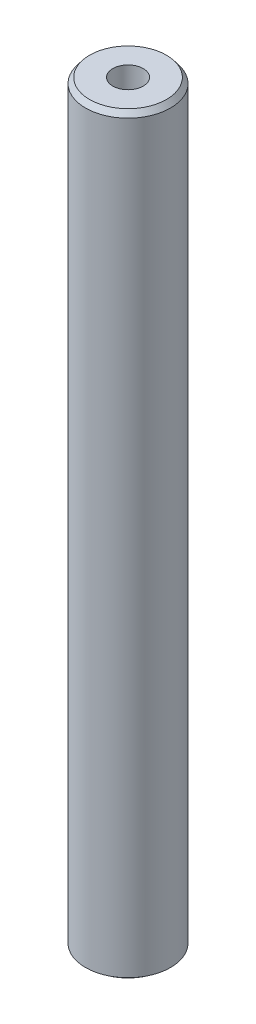
from build123d import *
from OCP.BRepFilletAPI import BRepFilletAPI_MakeChamfer

# Parameters (mm, degrees)
SKETCH1_R           = 17.5
BOSS_EXTRUDE1_DEPTH = 310.649268109
SKETCH2_R           = 6.274847593
CUT_EXTRUDE1_DEPTH  = 312.633547258
CHAMFER1_SIZE       = 2.213915599
CHAMFER1_SIZE2      = 1.661453647


with BuildPart() as part:
    # Sketch1 → Boss-Extrude1 (new body)
    with BuildSketch(Plane(origin=(0, 0, 0), x_dir=(1, 0, 0), z_dir=(0, 1, 0))):
        Circle(SKETCH1_R)
    extrude(amount=BOSS_EXTRUDE1_DEPTH)

    # Sketch2 → Cut-Extrude1 (cut, through all)
    with BuildSketch(Plane(origin=(0, 0, 0), x_dir=(1, 0, 0), z_dir=(0, 1, 0))):
        Circle(SKETCH2_R)
    extrude(amount=CUT_EXTRUDE1_DEPTH, mode=Mode.SUBTRACT)

    # Chamfer1: one chamfer whose edges measure the first distance from different faces: ONE call of the kernel's chamfer builder (chamfer() names one face for all edges)
    chamfer1_edges_1 = [part.edges().sort_by_distance(p)[0] for p in [
        (-17.5, 310.649268109, 0),
    ]]
    chamfer1_side_1 = [part.faces().sort_by_distance(p)[0] for p in [
        (-17.5, 155.324634054, 0),
    ]]
    chamfer1_edges_2 = [part.edges().sort_by_distance(p)[0] for p in [
        (-17.5, 0, 0),
    ]]
    chamfer1_side_2 = [part.faces().sort_by_distance(p)[0] for p in [
        (-17.005025253, 0, 0),
    ]]
    chamfer1 = BRepFilletAPI_MakeChamfer(part.part.solid().wrapped)
    for e in chamfer1_edges_1:
        chamfer1.Add(CHAMFER1_SIZE, CHAMFER1_SIZE2, e.wrapped, chamfer1_side_1[0].wrapped)  # the first distance lies on this face
    for e in chamfer1_edges_2:
        chamfer1.Add(CHAMFER1_SIZE, CHAMFER1_SIZE2, e.wrapped, chamfer1_side_2[0].wrapped)  # the first distance lies on this face
    add(Compound.cast(chamfer1.Shape()), mode=Mode.REPLACE)


solid = part.part
